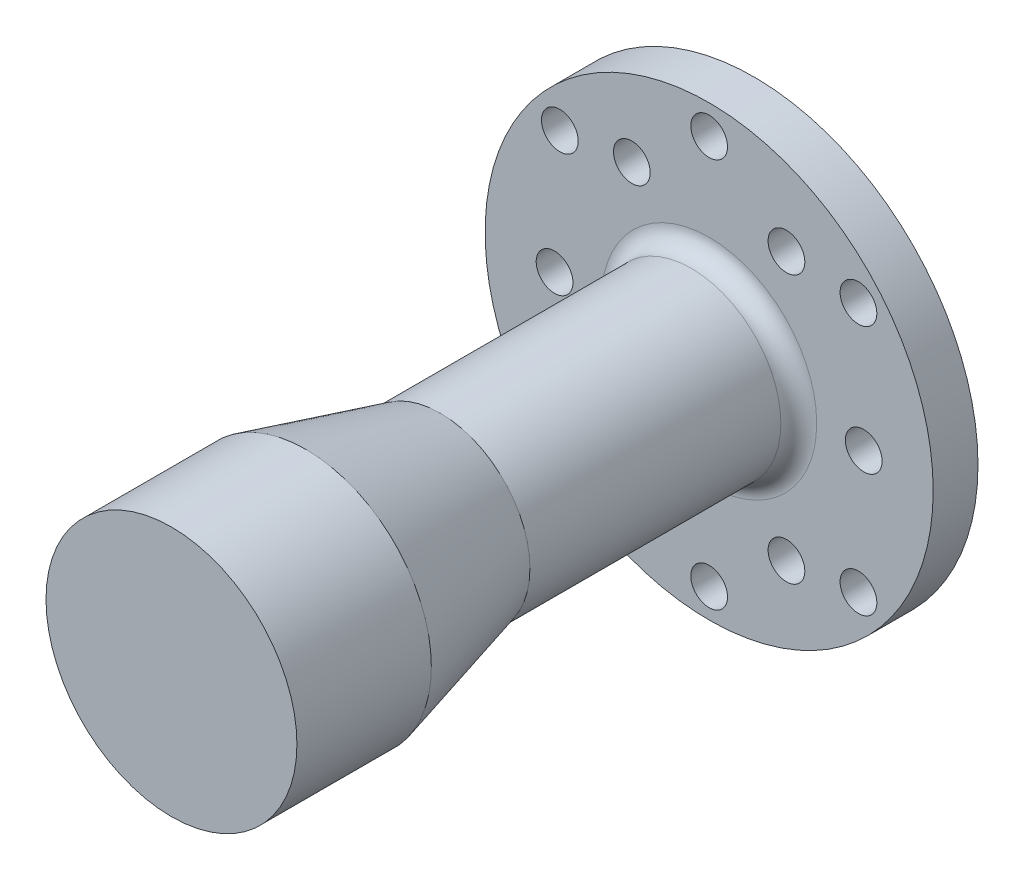
from build123d import *

# Parameters (mm, degrees)
SKETCH_1_R       = 25
SKETCH_1_R_2     = 2.05
EXTRUDE_1_DEPTH  = 5
SKETCH_2_R       = 10
EXTRUDE_2_DEPTH  = 60
FILLET_1_R       = 2
SKETCH_4_R       = 14
EXTRUDE_3_DEPTH  = 15
CHAMFER_1_SIZE   = 15
CHAMFER_1_SIZE_2 = 4


with BuildPart() as part:
    # 草图1 → 凸台-拉伸1 (new body)
    with BuildSketch(Plane.XY):
        Circle(SKETCH_1_R)
        with Locations((0, 21.75)):
            Circle(SKETCH_1_R_2, mode=Mode.SUBTRACT)
        with Locations((16.661466638, 13.980630511)):
            Circle(SKETCH_1_R_2, mode=Mode.SUBTRACT)
        with Locations((-16.661466638, 13.980630511)):
            Circle(SKETCH_1_R_2, mode=Mode.SUBTRACT)
        with Locations(Location((16.661466638, -13.980630511, 0), (0, 0, 180))):
            Circle(SKETCH_1_R_2, mode=Mode.SUBTRACT)
        with Locations(Location((0, -21.75, 0), (0, 0, 180))):
            Circle(SKETCH_1_R_2, mode=Mode.SUBTRACT)
        with Locations(Location((-16.661466638, -13.980630511, 0), (0, 0, 180))):
            Circle(SKETCH_1_R_2, mode=Mode.SUBTRACT)
        with Locations((8.625, 14.938938215)):
            Circle(SKETCH_1_R_2, mode=Mode.SUBTRACT)
        with Locations((17.25, 0)):
            Circle(SKETCH_1_R_2, mode=Mode.SUBTRACT)
        with Locations((8.625, -14.938938215)):
            Circle(SKETCH_1_R_2, mode=Mode.SUBTRACT)
        with Locations((-8.625, -14.938938215)):
            Circle(SKETCH_1_R_2, mode=Mode.SUBTRACT)
        with Locations((-17.25, 0)):
            Circle(SKETCH_1_R_2, mode=Mode.SUBTRACT)
        with Locations((-8.625, 14.938938215)):
            Circle(SKETCH_1_R_2, mode=Mode.SUBTRACT)
    extrude(amount=EXTRUDE_1_DEPTH)

    # 草图2 → 凸台-拉伸2 (add)
    with BuildSketch(Plane.XY.offset(5)):
        with Locations(Location((0, 0, 0), (0, 0, 180))):
            Circle(SKETCH_2_R)
    extrude(amount=EXTRUDE_2_DEPTH)

    # 圆角1
    fillet_1_edges = [part.edges().sort_by_distance(p)[0] for p in [
        (10, 0, 5),
    ]]
    fillet(fillet_1_edges, radius=FILLET_1_R)

    # 草图4 → 凸台-拉伸3 (add)
    with BuildSketch(Plane.XY.offset(65)):
        Circle(SKETCH_4_R)
    extrude(amount=-EXTRUDE_3_DEPTH)

    # 倒角1
    # the kernel refuses this chamfer: 15, 4 mm, written as the material it adds along each edge
    with BuildSketch(Plane(origin=(0, 0, 50), x_dir=(-1, 0, 0), z_dir=(0, -1, 0))) as chamfer_1_piece_1_section:
        Polygon((10, CHAMFER_1_SIZE), (10 + CHAMFER_1_SIZE_2, 0), (10, 0), align=None)
    chamfer_1_piece_1 = revolve(axis=Axis((0, 0, 50), (0, 0, -1)), mode=Mode.PRIVATE)
    chamfer_1_piece_1 = chamfer_1_piece_1 & Plane(origin=(0, 0, 42.245414998), x_dir=(1, 0, 0), z_dir=(0, 0, 1)) * Cylinder(14, 60, mode=Mode.PRIVATE)
    add(chamfer_1_piece_1)


solid = part.part
